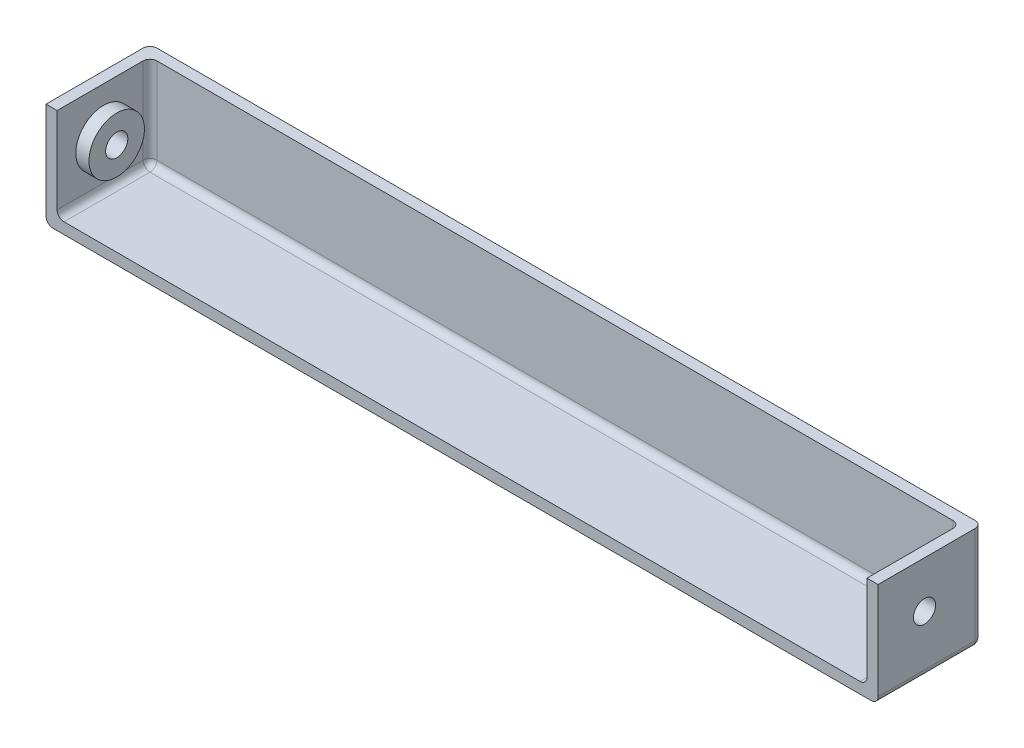
from build123d import *

# Parameters (mm, degrees)
SKETCH_1_W             = 120
SKETCH_1_H             = 15
SM_BASE_FLANGE_1_DEPTH = 1.6
EXTRUDE_1_OUTLINE_W    = 116.8
EXTRUDE_1_OUTLINE_H    = 1.6
EXTRUDE_1_DEPTH        = 13.4
SKETCH_37_5_W          = 1.6
SKETCH_37_5_H          = 15
EXTRUDE_2_DEPTH        = 13.4
SKETCH_45_R            = 4
EXTRUDE_4_DEPTH        = 1.9
SKETCH_46_R            = 1.6
CUT_EXTRUDE_2_DEPTH    = 119.223559412
FILLET_3_R             = 1
FILLET_4_R             = 1


# Read off the part's stored shape, not the designer's step: 拉伸-薄壁1
# Sheet-metal steps are written as plain solids
with BuildPart() as part:
    # Sketch 1 → 基体-法兰1 (new body)
    with BuildSketch(Plane.XY):
        with Locations((0, 7.5)):
            Rectangle(SKETCH_1_W, SKETCH_1_H)
    extrude(amount=-SM_BASE_FLANGE_1_DEPTH)

    # 拉伸-薄壁1 outline → 拉伸-薄壁1 (add)
    with BuildSketch(Plane.XY):
        with Locations((0, 0.8)):
            Rectangle(EXTRUDE_1_OUTLINE_W, EXTRUDE_1_OUTLINE_H)
    extrude(amount=EXTRUDE_1_DEPTH)

    # 草图37<5> → 凸台-拉伸2 (add)
    with BuildSketch(Plane.XY):
        with Locations((-59.2, 7.5)):
            Rectangle(SKETCH_37_5_W, SKETCH_37_5_H)
        with Locations((59.2, 7.5)):
            Rectangle(SKETCH_37_5_W, SKETCH_37_5_H)
    extrude(amount=EXTRUDE_2_DEPTH)

    # 草图45 → 凸台-拉伸4 (add)
    with BuildSketch(Plane.ZY.offset(-58.4)):
        with Locations(Location((6.7, 8.3, 0), (0, 0, 90))):
            Circle(SKETCH_45_R)
    extrude_4 = extrude(amount=EXTRUDE_4_DEPTH)

    # 镜向1: 凸台-拉伸4 across plane
    add(extrude_4.mirror(Plane(origin=(0, 0, 0), x_dir=(0, 0, 1), z_dir=(1, 0, 0))))

    # 草图46 → 切除-拉伸2 (cut, through all)
    with BuildSketch(Plane.ZY.offset(-56.5)):
        with Locations(Location((6.7, 8.3, 0), (0, 0, 270))):
            Circle(SKETCH_46_R)
    cut_extrude_2 = extrude(amount=-CUT_EXTRUDE_2_DEPTH, mode=Mode.SUBTRACT)

    # 镜向2: 切除-拉伸2 across plane
    add(cut_extrude_2.mirror(Plane(origin=(0, 0, 0), x_dir=(0, 0, 1), z_dir=(1, 0, 0))), mode=Mode.SUBTRACT)

    # 圆角3
    fillet_3_edges = [part.edges().sort_by_distance(p)[0] for p in [
        (60, 7.5, -1.6),
        (0, 1.6, 0),
        (58.4, 8.3, 0),
        (-60, 7.5, -1.6),
        (-58.4, 8.3, 0),
        (0, 0, -1.6),
        (60, 0, 5.9),
        (-60, 0, 5.9),
    ]]
    fillet(fillet_3_edges, radius=FILLET_3_R)

    # 圆角4
    # the kernel refuses this fillet: 1 mm, written as the material it adds along each edge
    with BuildSketch(Plane(origin=(-57.4, 2.6, 1), x_dir=(0, -1, 0), z_dir=(-1, 0, 0))) as fillet_4_piece_1_section:
        Polygon((0, 0), (FILLET_4_R, 0), (FILLET_4_R, -FILLET_4_R), (0, -FILLET_4_R), align=None)
    fillet_4_piece_1 = extrude(amount=FILLET_4_R, mode=Mode.PRIVATE)
    fillet_4_piece_1 = fillet_4_piece_1 - Plane(origin=(-57.4, 2.6, 1), x_dir=(0, 0.7071067811865475, 0.7071067811865475), z_dir=(-1, 0, 0)) * Sphere(FILLET_4_R, mode=Mode.PRIVATE)
    add(fillet_4_piece_1)
    with BuildSketch(Plane(origin=(57.4, 2.6, 1), x_dir=(0, -1, 0), z_dir=(1, 0, 0))) as fillet_4_piece_2_section:
        Polygon((0, 0), (FILLET_4_R, 0), (FILLET_4_R, FILLET_4_R), (0, FILLET_4_R), align=None)
    fillet_4_piece_2 = extrude(amount=FILLET_4_R, mode=Mode.PRIVATE)
    fillet_4_piece_2 = fillet_4_piece_2 - Plane(origin=(57.4, 2.6, 1), x_dir=(0, 0.7071067811865475, 0.7071067811865475), z_dir=(1, 0, 0)) * Sphere(FILLET_4_R, mode=Mode.PRIVATE)
    add(fillet_4_piece_2)
    with BuildSketch(Plane(origin=(58.4, 1.6, 1), x_dir=(0, 1, 0), z_dir=(0, 0, 1))) as fillet_4_piece_3:
        with BuildLine():
            CenterArc((FILLET_4_R, FILLET_4_R), FILLET_4_R, 180, 90)
            Line((0, FILLET_4_R), (0, 0))
            Line((0, 0), (FILLET_4_R, 0))
        make_face()
    extrude(amount=12.4)
    with BuildSketch(Plane(origin=(-58.4, 1.6, 1), x_dir=(0, 1, 0), z_dir=(0, 0, 1))) as fillet_4_piece_4:
        with BuildLine():
            CenterArc((FILLET_4_R, -FILLET_4_R), FILLET_4_R, 90, 90)
            Line((0, -FILLET_4_R), (0, 0))
            Line((0, 0), (FILLET_4_R, 0))
        make_face()
    extrude(amount=12.4)


solid = part.part
